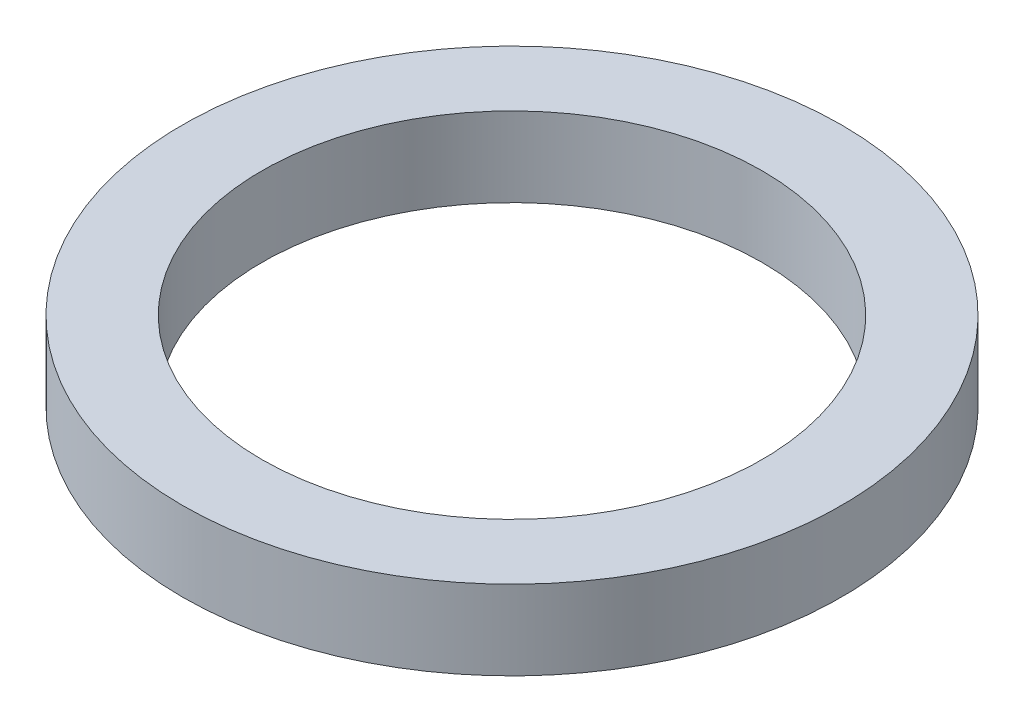
from build123d import *

# Parameters (mm, degrees)
SKETCH1_R           = 5.27
SKETCH1_R_2         = 4
BOSS_EXTRUDE1_DEPTH = 1.27


with BuildPart() as part:
    # Sketch1 → Boss-Extrude1 (new body)
    with BuildSketch(Plane(origin=(0, 0, 0), x_dir=(1, 0, 0), z_dir=(0, 1, 0))):
        Circle(SKETCH1_R)
        Circle(SKETCH1_R_2, mode=Mode.SUBTRACT)
    extrude(amount=BOSS_EXTRUDE1_DEPTH)


solid = part.part
